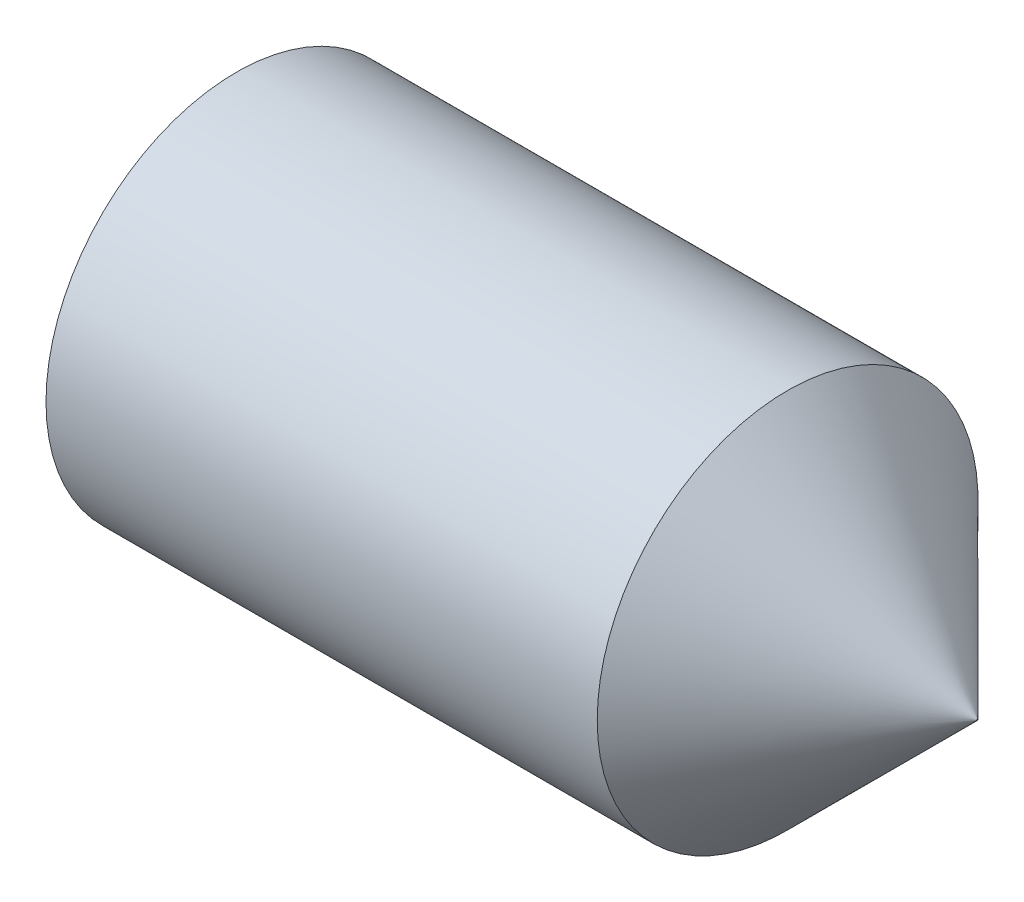
from build123d import *

# Parameters (mm, degrees)
HEX_2_DEPTH = 2.1


with BuildPart() as part:
    # BodySke → BaseBody (revolve)
    with BuildSketch(Plane.XY):
        Polygon((0, 0), (0, 1.2195), (0.161946751, 1.5), (4.505, 1.5), (6, 0.005), (6, 0), align=None)
    revolve(axis=Axis((-12.7, 0, 0), (1, 0, 0)))

    # Sketch2 → Hex 2 (cut)
    with BuildSketch(Plane.ZY):
        Polygon((0.433012702, 0.75), (-0.433012702, 0.75), (-0.866025404, 0), (-0.433012702, -0.75), (0.433012702, -0.75), (0.866025404, 0), align=None)
    extrude(amount=-HEX_2_DEPTH, mode=Mode.SUBTRACT)


solid = part.part
